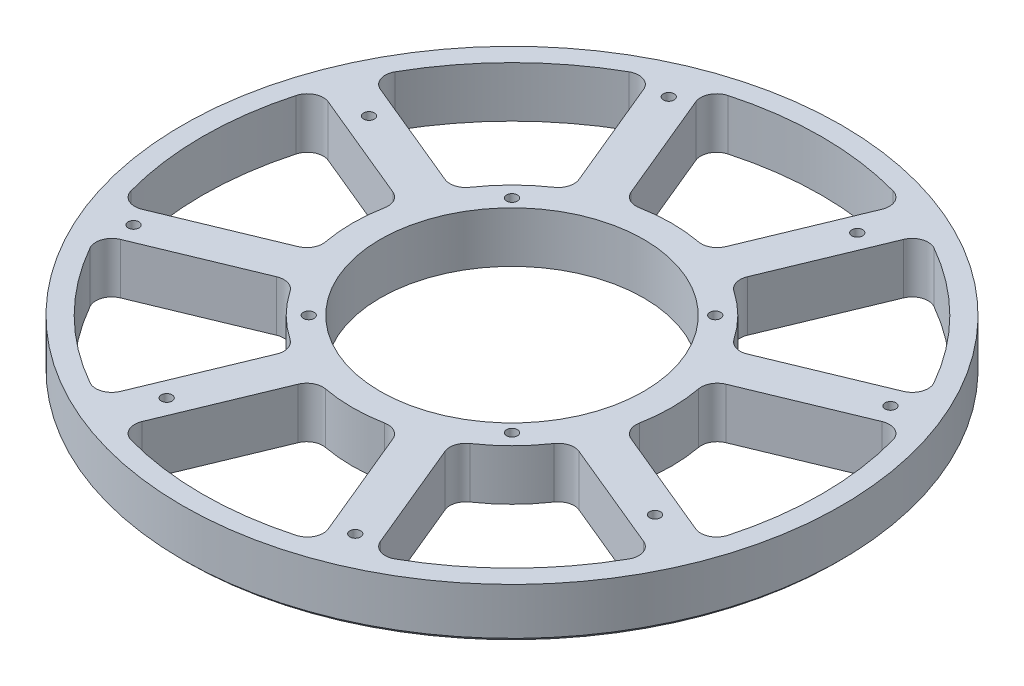
from build123d import *

# Parameters (mm, degrees)
SKETCH2_W                = 82.55
SKETCH2_H                = 12.7
F_6_32_TAPPED_HOLE1_D    = 2.7051
CIRPATTERN3_COUNT        = 4
CUT_EXTRUDE1_DEPTH       = 118.432086757
FILLET1_R                = 4
CIRPATTERN4_COUNT        = 8
FILLET1_OF_CIRPATTERN4_R = 4
CHAMFER2_SIZE            = 1
SKETCH9_R                = 33
CUT_EXTRUDE2_DEPTH       = 118.432086757


with BuildPart() as part:
    # Sketch2 → Revolve1 (revolve)
    with BuildSketch(Plane(origin=(0, 0, 0), x_dir=(0, 0, -1), z_dir=(1, 0, 0))):
        with Locations((-41.275, 6.35)):
            Rectangle(SKETCH2_W, SKETCH2_H)
    revolve(axis=Axis((0, -0.635, 0), (0, 1, 0)))

    # #6-32 Tapped Hole1 (through all)
    with Locations(Plane(origin=(0, 12.7, 0), x_dir=(1, 0, 0), z_dir=(0, 1, 0))):
        with Locations((-27.763683018, 67.027460084), (-61.160825052, 25.333643223), (-25.455844123, 25.455844123)):
            f_6_32_tapped_hole1 = Hole(F_6_32_TAPPED_HOLE1_D / 2)

    # CirPattern3: #6-32 Tapped Hole1 ×4 about axis
    cirpattern3_axis = Axis((0, -0.635, 0), (0, 1, 0))
    for i in range(1, CIRPATTERN3_COUNT):
        add(f_6_32_tapped_hole1.rotate(cirpattern3_axis, i * 360 / CIRPATTERN3_COUNT), mode=Mode.SUBTRACT)

    # Sketch8 → Cut-Extrude1 (cut, through all)
    with BuildSketch(Plane(origin=(0, 12.7, 0), x_dir=(1, 0, 0), z_dir=(0, 1, 0))):
        with BuildLine():
            Line((-10.567880231, 38.578749428), (-24.995954941, 73.411203073))
            ThreePointArc((-24.995954941, 73.411203073), (0, 77.55), (24.995954941, 73.411203073))
            Line((24.995954941, 73.411203073), (10.567880231, 38.578749428))
            ThreePointArc((10.567880231, 38.578749428), (0, 40), (-10.567880231, 38.578749428))
        make_face()
    cut_extrude1 = extrude(amount=-CUT_EXTRUDE1_DEPTH, mode=Mode.SUBTRACT)

    # Fillet1
    fillet1_edges = [part.edges().sort_by_distance(p)[0] for p in [
        (10.567880231, 6.35, -38.578749428),
        (24.995954941, 6.35, -73.411203073),
        (-10.567880231, 6.35, -38.578749428),
        (-24.995954941, 6.35, -73.411203073),
    ]]
    fillet(fillet1_edges, radius=FILLET1_R)

    # CirPattern4: Cut-Extrude1 ×8 about axis
    cirpattern4_axis = Axis((0, -0.635, 0), (0, 1, 0))
    for i in range(1, CIRPATTERN4_COUNT):
        add(cut_extrude1.rotate(cirpattern4_axis, i * 360 / CIRPATTERN4_COUNT), mode=Mode.SUBTRACT)

    # Fillet1 of CirPattern4
    fillet1_of_cirpattern4_edges = [part.edges().sort_by_distance(p)[0] for p in [
        (-19.806675556, 6.35, -34.751915104),
        (-34.234750266, 6.35, -69.584368749),
        (-34.751915104, 6.35, -19.806675556),
        (-69.584368749, 6.35, -34.234750266),
        (-38.578749428, 6.35, -10.567880231),
        (-73.411203073, 6.35, -24.995954941),
        (-38.578749428, 6.35, 10.567880231),
        (-73.411203073, 6.35, 24.995954941),
        (-34.751915104, 6.35, 19.806675556),
        (-69.584368749, 6.35, 34.234750266),
        (-19.806675556, 6.35, 34.751915104),
        (-34.234750266, 6.35, 69.584368749),
        (-10.567880231, 6.35, 38.578749428),
        (-24.995954941, 6.35, 73.411203073),
        (10.567880231, 6.35, 38.578749428),
        (24.995954941, 6.35, 73.411203073),
        (19.806675556, 6.35, 34.751915104),
        (34.234750266, 6.35, 69.584368749),
        (34.751915104, 6.35, 19.806675556),
        (69.584368749, 6.35, 34.234750266),
        (38.578749428, 6.35, 10.567880231),
        (73.411203073, 6.35, 24.995954941),
        (38.578749428, 6.35, -10.567880231),
        (73.411203073, 6.35, -24.995954941),
        (34.751915104, 6.35, -19.806675556),
        (69.584368749, 6.35, -34.234750266),
        (19.806675556, 6.35, -34.751915104),
        (34.234750266, 6.35, -69.584368749),
    ]]
    fillet(fillet1_of_cirpattern4_edges, radius=FILLET1_OF_CIRPATTERN4_R)

    # Chamfer2
    chamfer2_edges = [part.edges().sort_by_distance(p)[0] for p in [
        (0, 0, -82.55),
    ]]
    chamfer(chamfer2_edges, length=CHAMFER2_SIZE)

    # Sketch9 → Cut-Extrude2 (cut, through all)
    with BuildSketch(Plane(origin=(0, 12.7, 0), x_dir=(1, 0, 0), z_dir=(0, 1, 0))):
        Circle(SKETCH9_R)
    extrude(amount=-CUT_EXTRUDE2_DEPTH, mode=Mode.SUBTRACT)


solid = part.part
